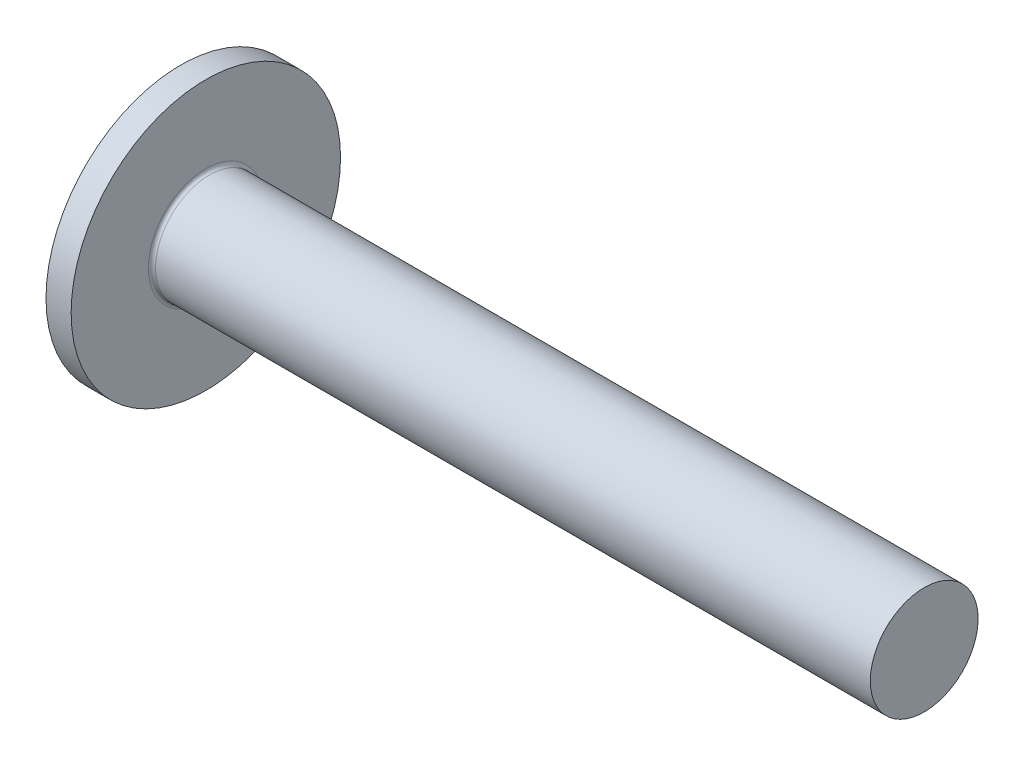
from build123d import *

# Parameters (mm, degrees)
RECPAT_COUNT = 2
RECPAT_ANGLE = 90


with BuildPart() as part:
    # Fillet1: read off the stored shape, not the designer's step
    # Fillet1 outline → Fillet1 (revolve)
    with BuildSketch(Plane.YX):
        with BuildLine():
            Line((1.5, 2.45), (1.5, 22.35))
            Line((1.5, 22.35), (0, 22.35))
            Line((0, 22.35), (0, 1.65))
            Line((0, 1.65), (3.75, 1.65))
            Line((3.75, 1.65), (3.75, 2.35))
            Line((3.75, 2.35), (1.6, 2.35))
            ThreePointArc((1.6, 2.35), (1.529289322, 2.379289322), (1.5, 2.45))
        make_face()
    revolve(axis=Axis((0, 0, 0), (1, 0, 0)))

    # PanSke → Pan (revolve)
    with BuildSketch(Plane.XY, mode=Mode.PRIVATE) as pan_sk:
        with BuildLine():
            Line((1.65, 3.133289007), (1.65, 0))
            Line((1.65, 0), (0, 0))
            ThreePointArc((0, 0), (0.437709114, 1.770593121), (1.65, 3.133289007))
        make_face()
    revolve(pan_sk.sketch.rotate(Axis((0, 0, 0), (1, 0, 0)), 90), axis=Axis((0, 0, 0), (1, 0, 0)))

    # Sketch3 → Recess section 0
    with BuildSketch(Plane(origin=(0, 0, 0), x_dir=(0, 0, -1), z_dir=(1, 0, 0))):
        with BuildLine():
            Line((-0.37, 1.45), (0.37, 1.45))
            Line((0.37, 1.45), (0.37, -1.45))
            Line((0.37, -1.45), (-0.37, -1.45))
            Line((-0.37, -1.45), (-0.37, 1.45))
        make_face()
    # Sketch4 → Recess section 1
    with BuildSketch(Plane(origin=(1.83, 0, 0), x_dir=(0, 0, -1), z_dir=(1, 0, 0))):
        with BuildLine():
            Line((-0.37, 2.106524682), (0.37, 2.106524682))
            Line((0.37, 2.106524682), (0.37, -2.106524682))
            Line((0.37, -2.106524682), (-0.37, -2.106524682))
            Line((-0.37, -2.106524682), (-0.37, 2.106524682))
        make_face()
    recess = loft(mode=Mode.SUBTRACT)

    # RecPat: Recess ×2 about axis
    recpat_axis = Axis((0, 0, 0), (1, 0, 0))
    for i in range(1, RECPAT_COUNT):
        add(recess.rotate(recpat_axis, i * RECPAT_ANGLE / (RECPAT_COUNT - 1)), mode=Mode.SUBTRACT)

    # RecCorSke → RecessCore (revolve, cut)
    with BuildSketch(Plane.XY, mode=Mode.PRIVATE) as recesscore_sk:
        Polygon((0, 0), (0, 0.877663335), (4.6, 0.556), (4.780655351, 0), align=None)
    revolve(recesscore_sk.sketch.rotate(Axis((-3.175, 0, 0), (1, 0, 0)), 90), axis=Axis((-3.175, 0, 0), (1, 0, 0)), mode=Mode.SUBTRACT)


solid = part.part
